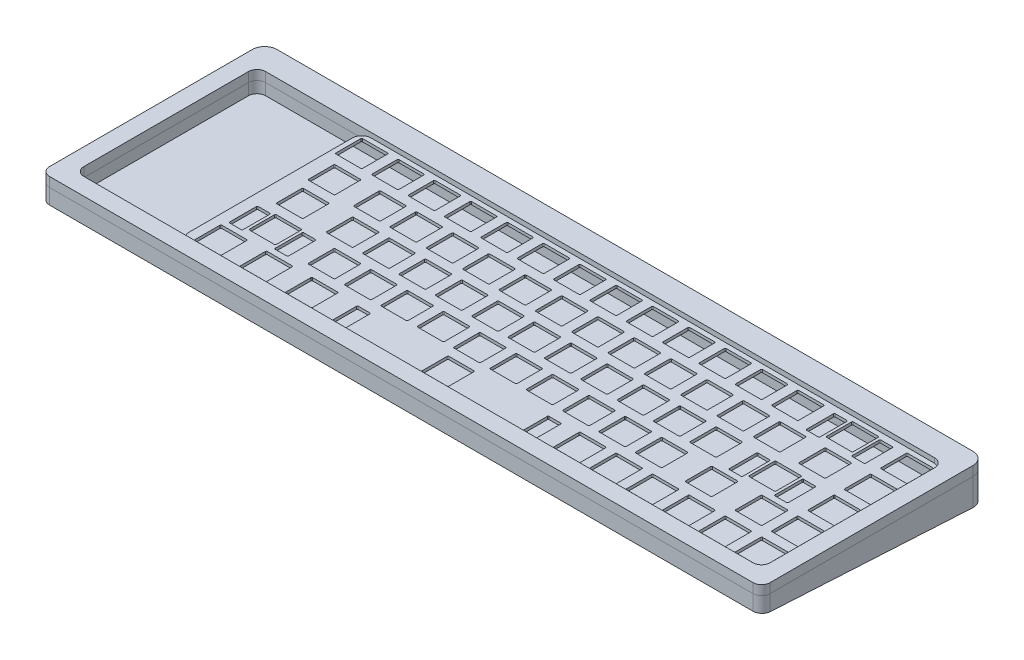
from build123d import *

# Parameters (mm, degrees)
BOSS_EXTRUDE1_DEPTH = 13
SKETCH4_W           = 377.65
SKETCH4_H           = 117.25
BOSS_EXTRUDE3_DEPTH = 10.5
CUT_EXTRUDE3_DEPTH  = 400
FILLET1_R           = 6.5
FILLET4_R           = 4.5
FILLET2_R           = 4.5
SKETCH10_W          = 25
SKETCH10_H          = 7
SKETCH10_H_2        = 7.5
CUT_EXTRUDE2_DEPTH  = 2.5
FILLET3_R           = 4.5
SKETCH9_R           = 1
BOSS_EXTRUDE4_DEPTH = 1.5
SKETCH13_W          = 359.65
SKETCH13_H          = 95.25
BOSS_EXTRUDE5_DEPTH = 1.6


with BuildPart() as part:
    # Sketch2 → Boss-Extrude1 (new body)
    with BuildSketch(Plane(origin=(0, 0, 0), x_dir=(1, 0, 0), z_dir=(0, 1, 0))):
        Polygon((-188.825, 60.625), (-188.825, 54.625), (-188.825, -56.625), (188.825, -56.625), (188.825, 60.625), (-182.825, 60.625), align=None)
        Polygon((-179.825, -46.625), (-179.825, 46.625), (-179.825, 47.625), (-178.825, 47.625), (178.825, 47.625), (179.825, 47.625), (179.825, 46.625), (179.825, -46.625), (179.825, -47.625), (178.825, -47.625), (-178.825, -47.625), (-179.825, -47.625), align=None, mode=Mode.SUBTRACT)
    extrude(amount=BOSS_EXTRUDE1_DEPTH)

    # Sketch4 → Boss-Extrude3 (add)
    with BuildSketch(Plane.XZ):
        with Locations((0, -2)):
            Rectangle(SKETCH4_W, SKETCH4_H)
    extrude(amount=BOSS_EXTRUDE3_DEPTH)

    # Sketch12 → Cut-Extrude3 (cut)
    with BuildSketch(Plane.ZY.offset(188.825)):
        Polygon((-60.625, -10.5), (-60.625, -6.5), (56.625, 0), (56.625, -10.5), align=None)
    extrude(amount=-CUT_EXTRUDE3_DEPTH, mode=Mode.SUBTRACT)

    # Fillet1
    fillet1_edges = [part.edges().sort_by_distance(p)[0] for p in [
        (188.825, 3.25, -60.625),
        (-188.825, 3.25, -60.625),
    ]]
    fillet(fillet1_edges, radius=FILLET1_R)

    # Fillet4
    fillet4_edges = [part.edges().sort_by_distance(p)[0] for p in [
        (188.825, 6.5, 56.625),
        (-188.825, 6.5, 56.625),
    ]]
    fillet(fillet4_edges, radius=FILLET4_R)

    # Fillet2
    fillet2_edges = [part.edges().sort_by_distance(p)[0] for p in [
        (179.825, 6.5, 47.625),
        (-179.825, 6.5, 47.625),
        (179.825, 6.5, -47.625),
        (-179.825, 6.5, -47.625),
    ]]
    fillet(fillet2_edges, radius=FILLET2_R)


with BuildPart() as body_2:
    # Split1: the piece on the far side of the plane
    add(part.part)
    split(bisect_by=Plane.ZX.offset(8), keep=Keep.BOTTOM)


with BuildPart() as part_1:
    add(part.part)

    # Split1
    split(bisect_by=Plane.ZX.offset(8), keep=Keep.TOP)

    # Sketch10 → Cut-Extrude2 (cut)
    with BuildSketch(Plane(origin=(0, 8, 0), x_dir=(1, 0, 0), z_dir=(0, 1, 0))):
        Polygon((-108.245613046, 55.125), (-108.245613046, 47.625), (-83.245613046, 47.625), (-83.245613046, 55.125), (-90.245613046, 55.125), align=None)
        with Locations((-93.199035781, -51.125)):
            Rectangle(SKETCH10_W, SKETCH10_H)
        with Locations((-15.745613046, 51.375)):
            Rectangle(SKETCH10_W, SKETCH10_H_2)
        with Locations((-13.199035781, -51.125)):
            Rectangle(SKETCH10_W, SKETCH10_H)
        with Locations((64.254386954, 51.375)):
            Rectangle(SKETCH10_W, SKETCH10_H_2)
        with Locations((66.800964219, -51.125)):
            Rectangle(SKETCH10_W, SKETCH10_H)
        with Locations((144.254386954, 51.375)):
            Rectangle(SKETCH10_W, SKETCH10_H_2)
        with Locations((146.800964219, -51.125)):
            Rectangle(SKETCH10_W, SKETCH10_H)
    extrude(amount=CUT_EXTRUDE2_DEPTH, mode=Mode.SUBTRACT)

    # Fillet3
    fillet3_edges = [part_1.edges().sort_by_distance(p)[0] for p in [
        (-108.245613046, 9.25, -55.125),
        (-28.245613046, 9.25, -55.125),
        (-3.245613046, 9.25, -55.125),
        (-83.245613046, 9.25, -55.125),
        (76.754386954, 9.25, -55.125),
        (51.754386954, 9.25, -55.125),
        (131.754386954, 9.25, -55.125),
        (156.754386954, 9.25, -55.125),
        (134.300964219, 9.25, 54.625),
        (159.300964219, 9.25, 54.625),
        (79.300964219, 9.25, 54.625),
        (54.300964219, 9.25, 54.625),
        (-25.699035781, 9.25, 54.625),
        (-0.699035781, 9.25, 54.625),
        (-80.699035781, 9.25, 54.625),
        (-105.699035781, 9.25, 54.625),
    ]]
    fillet(fillet3_edges, radius=FILLET3_R)


with BuildPart() as body_3:
    # Sketch9 → Boss-Extrude4 (new body)
    with BuildSketch(Plane(origin=(0, 0, 0), x_dir=(1, 0, 0), z_dir=(0, 1, 0))):
        with BuildLine():
            Line((-103.245613046, 47.625), (-119.970321887, 47.625))
            ThreePointArc((-119.970321887, 47.625), (-123.505855793, 46.160533906), (-124.970321887, 42.625))
            Line((-124.970321887, 42.625), (-124.970321887, -42.625))
            ThreePointArc((-124.970321887, -42.625), (-123.505855793, -46.160533906), (-119.970321887, -47.625))
            Line((-119.970321887, -47.625), (-100.699035781, -47.625))
            Line((-100.699035781, -47.625), (-100.699035781, -52.625))
            ThreePointArc((-100.699035781, -52.625), (-100.113249344, -54.039213562), (-98.699035781, -54.625))
            Line((-98.699035781, -54.625), (-87.699035781, -54.625))
            ThreePointArc((-87.699035781, -54.625), (-86.284822219, -54.039213562), (-85.699035781, -52.625))
            Line((-85.699035781, -52.625), (-85.699035781, -47.625))
            Line((-85.699035781, -47.625), (-20.699035781, -47.625))
            Line((-20.699035781, -47.625), (-20.699035781, -52.625))
            ThreePointArc((-20.699035781, -52.625), (-20.113249344, -54.039213562), (-18.699035781, -54.625))
            Line((-18.699035781, -54.625), (-7.699035781, -54.625))
            ThreePointArc((-7.699035781, -54.625), (-6.284822219, -54.039213562), (-5.699035781, -52.625))
            Line((-5.699035781, -52.625), (-5.699035781, -47.625))
            Line((-5.699035781, -47.625), (59.300964219, -47.625))
            Line((59.300964219, -47.625), (59.300964219, -52.625))
            ThreePointArc((59.300964219, -52.625), (59.886750656, -54.039213562), (61.300964219, -54.625))
            Line((61.300964219, -54.625), (72.300964219, -54.625))
            ThreePointArc((72.300964219, -54.625), (73.715177781, -54.039213562), (74.300964219, -52.625))
            Line((74.300964219, -52.625), (74.300964219, -47.625))
            Line((74.300964219, -47.625), (139.300964219, -47.625))
            Line((139.300964219, -47.625), (139.300964219, -52.625))
            ThreePointArc((139.300964219, -52.625), (139.886750656, -54.039213562), (141.300964219, -54.625))
            Line((141.300964219, -54.625), (152.300964219, -54.625))
            ThreePointArc((152.300964219, -54.625), (153.715177781, -54.039213562), (154.300964219, -52.625))
            Line((154.300964219, -52.625), (154.300964219, -47.625))
            Line((154.300964219, -47.625), (174.829678113, -47.625))
            ThreePointArc((174.829678113, -47.625), (178.287915068, -46.2361767), (179.825, -42.841238864))
            Line((179.825, -42.841238864), (179.825, 42.841238864))
            ThreePointArc((179.825, 42.841238864), (178.287915068, 46.2361767), (174.829678113, 47.625))
            Line((174.829678113, 47.625), (151.754386954, 47.625))
            Line((151.754386954, 47.625), (151.754386954, 53.125))
            ThreePointArc((151.754386954, 53.125), (151.168600516, 54.539213562), (149.754386954, 55.125))
            Line((149.754386954, 55.125), (138.754386954, 55.125))
            ThreePointArc((138.754386954, 55.125), (137.340173391, 54.539213562), (136.754386954, 53.125))
            Line((136.754386954, 53.125), (136.754386954, 47.625))
            Line((136.754386954, 47.625), (71.754386954, 47.625))
            Line((71.754386954, 47.625), (71.754386954, 53.125))
            ThreePointArc((71.754386954, 53.125), (71.168600516, 54.539213562), (69.754386954, 55.125))
            Line((69.754386954, 55.125), (58.754386954, 55.125))
            ThreePointArc((58.754386954, 55.125), (57.340173391, 54.539213562), (56.754386954, 53.125))
            Line((56.754386954, 53.125), (56.754386954, 47.625))
            Line((56.754386954, 47.625), (-8.245613046, 47.625))
            Line((-8.245613046, 47.625), (-8.245613046, 53.125))
            ThreePointArc((-8.245613046, 53.125), (-8.831399484, 54.539213562), (-10.245613046, 55.125))
            Line((-10.245613046, 55.125), (-21.245613046, 55.125))
            ThreePointArc((-21.245613046, 55.125), (-22.659826609, 54.539213562), (-23.245613046, 53.125))
            Line((-23.245613046, 53.125), (-23.245613046, 47.625))
            Line((-23.245613046, 47.625), (-88.245613046, 47.625))
            Line((-88.245613046, 47.625), (-88.245613046, 53.125))
            ThreePointArc((-88.245613046, 53.125), (-88.831399484, 54.539213562), (-90.245613046, 55.125))
            Line((-90.245613046, 55.125), (-101.245613046, 55.125))
            ThreePointArc((-101.245613046, 55.125), (-102.659826609, 54.539213562), (-103.245613046, 53.125))
            Line((-103.245613046, 53.125), (-103.245613046, 47.625))
        make_face()
        with BuildLine():
            ThreePointArc((-120.064071887, -31.6), (-119.917625277, -31.246446609), (-119.564071887, -31.1))
            Line((-119.564071887, -31.1), (-106.564071887, -31.1))
            ThreePointArc((-106.564071887, -31.1), (-106.210518496, -31.246446609), (-106.064071887, -31.6))
            Line((-106.064071887, -31.6), (-106.064071887, -44.6))
            ThreePointArc((-106.064071887, -44.6), (-106.210518496, -44.953553391), (-106.564071887, -45.1))
            Line((-106.564071887, -45.1), (-119.564071887, -45.1))
            ThreePointArc((-119.564071887, -45.1), (-119.917625277, -44.953553391), (-120.064071887, -44.6))
            Line((-120.064071887, -44.6), (-120.064071887, -31.6))
        make_face(mode=Mode.SUBTRACT)
        with BuildLine():
            ThreePointArc((-96.251571887, -31.6), (-96.105125277, -31.246446609), (-95.751571887, -31.1))
            Line((-95.751571887, -31.1), (-82.751571887, -31.1))
            ThreePointArc((-82.751571887, -31.1), (-82.398018496, -31.246446609), (-82.251571887, -31.6))
            Line((-82.251571887, -31.6), (-82.251571887, -44.6))
            ThreePointArc((-82.251571887, -44.6), (-82.398018496, -44.953553391), (-82.751571887, -45.1))
            Line((-82.751571887, -45.1), (-95.751571887, -45.1))
            ThreePointArc((-95.751571887, -45.1), (-96.105125277, -44.953553391), (-96.251571887, -44.6))
            Line((-96.251571887, -44.6), (-96.251571887, -31.6))
        make_face(mode=Mode.SUBTRACT)
        with BuildLine():
            ThreePointArc((-72.439071887, -31.6), (-72.292625277, -31.246446609), (-71.939071887, -31.1))
            Line((-71.939071887, -31.1), (-58.939071887, -31.1))
            ThreePointArc((-58.939071887, -31.1), (-58.585518496, -31.246446609), (-58.439071887, -31.6))
            Line((-58.439071887, -31.6), (-58.439071887, -44.6))
            ThreePointArc((-58.439071887, -44.6), (-58.585518496, -44.953553391), (-58.939071887, -45.1))
            Line((-58.939071887, -45.1), (-71.939071887, -45.1))
            ThreePointArc((-71.939071887, -45.1), (-72.292625277, -44.953553391), (-72.439071887, -44.6))
            Line((-72.439071887, -44.6), (-72.439071887, -31.6))
        make_face(mode=Mode.SUBTRACT)
        with BuildLine():
            ThreePointArc((-47.501571887, -32.6), (-47.355125277, -32.246446609), (-47.001571887, -32.1))
            Line((-47.001571887, -32.1), (-41.001571887, -32.1))
            ThreePointArc((-41.001571887, -32.1), (-40.648018496, -32.246446609), (-40.501571887, -32.6))
            Line((-40.501571887, -32.6), (-40.501571887, -46.6))
            ThreePointArc((-40.501571887, -46.6), (-40.648018496, -46.953553391), (-41.001571887, -47.1))
            Line((-41.001571887, -47.1), (-47.001571887, -47.1))
            ThreePointArc((-47.001571887, -47.1), (-47.355125277, -46.953553391), (-47.501571887, -46.6))
            Line((-47.501571887, -46.6), (-47.501571887, -32.6))
        make_face(mode=Mode.SUBTRACT)
        with BuildLine():
            ThreePointArc((-1.001571887, -31.6), (-0.855125277, -31.246446609), (-0.501571887, -31.1))
            Line((-0.501571887, -31.1), (12.498428113, -31.1))
            ThreePointArc((12.498428113, -31.1), (12.851981504, -31.246446609), (12.998428113, -31.6))
            Line((12.998428113, -31.6), (12.998428113, -44.6))
            ThreePointArc((12.998428113, -44.6), (12.851981504, -44.953553391), (12.498428113, -45.1))
            Line((12.498428113, -45.1), (-0.501571887, -45.1))
            ThreePointArc((-0.501571887, -45.1), (-0.855125277, -44.953553391), (-1.001571887, -44.6))
            Line((-1.001571887, -44.6), (-1.001571887, -31.6))
        make_face(mode=Mode.SUBTRACT)
        with BuildLine():
            ThreePointArc((-118.977071887, -13.55), (-118.830625277, -13.196446609), (-118.477071887, -13.05))
            Line((-118.477071887, -13.05), (-112.477071887, -13.05))
            ThreePointArc((-112.477071887, -13.05), (-112.123518496, -13.196446609), (-111.977071887, -13.55))
            Line((-111.977071887, -13.55), (-111.977071887, -27.55))
            ThreePointArc((-111.977071887, -27.55), (-112.123518496, -27.903553391), (-112.477071887, -28.05))
            Line((-112.477071887, -28.05), (-118.477071887, -28.05))
            ThreePointArc((-118.477071887, -28.05), (-118.830625277, -27.903553391), (-118.977071887, -27.55))
            Line((-118.977071887, -27.55), (-118.977071887, -13.55))
        make_face(mode=Mode.SUBTRACT)
        with BuildLine():
            ThreePointArc((-95.101071887, -13.55), (-94.954625277, -13.196446609), (-94.601071887, -13.05))
            Line((-94.601071887, -13.05), (-88.601071887, -13.05))
            ThreePointArc((-88.601071887, -13.05), (-88.247518496, -13.196446609), (-88.101071887, -13.55))
            Line((-88.101071887, -13.55), (-88.101071887, -27.55))
            ThreePointArc((-88.101071887, -27.55), (-88.247518496, -27.903553391), (-88.601071887, -28.05))
            Line((-88.601071887, -28.05), (-94.601071887, -28.05))
            ThreePointArc((-94.601071887, -28.05), (-94.954625277, -27.903553391), (-95.101071887, -27.55))
            Line((-95.101071887, -27.55), (-95.101071887, -13.55))
        make_face(mode=Mode.SUBTRACT)
        with BuildLine():
            ThreePointArc((-110.539071887, -12.55), (-110.392625277, -12.196446609), (-110.039071887, -12.05))
            Line((-110.039071887, -12.05), (-97.039071887, -12.05))
            ThreePointArc((-97.039071887, -12.05), (-96.685518496, -12.196446609), (-96.539071887, -12.55))
            Line((-96.539071887, -12.55), (-96.539071887, -25.55))
            ThreePointArc((-96.539071887, -25.55), (-96.685518496, -25.903553391), (-97.039071887, -26.05))
            Line((-97.039071887, -26.05), (-110.039071887, -26.05))
            ThreePointArc((-110.039071887, -26.05), (-110.392625277, -25.903553391), (-110.539071887, -25.55))
            Line((-110.539071887, -25.55), (-110.539071887, -12.55))
        make_face(mode=Mode.SUBTRACT)
        with BuildLine():
            ThreePointArc((-79.582821887, -12.55), (-79.436375277, -12.196446609), (-79.082821887, -12.05))
            Line((-79.082821887, -12.05), (-66.082821887, -12.05))
            ThreePointArc((-66.082821887, -12.05), (-65.729268496, -12.196446609), (-65.582821887, -12.55))
            Line((-65.582821887, -12.55), (-65.582821887, -25.55))
            ThreePointArc((-65.582821887, -25.55), (-65.729268496, -25.903553391), (-66.082821887, -26.05))
            Line((-66.082821887, -26.05), (-79.082821887, -26.05))
            ThreePointArc((-79.082821887, -26.05), (-79.436375277, -25.903553391), (-79.582821887, -25.55))
            Line((-79.582821887, -25.55), (-79.582821887, -12.55))
        make_face(mode=Mode.SUBTRACT)
        with BuildLine():
            ThreePointArc((-60.532821887, -12.55), (-60.386375277, -12.196446609), (-60.032821887, -12.05))
            Line((-60.032821887, -12.05), (-47.032821887, -12.05))
            ThreePointArc((-47.032821887, -12.05), (-46.679268496, -12.196446609), (-46.532821887, -12.55))
            Line((-46.532821887, -12.55), (-46.532821887, -25.55))
            ThreePointArc((-46.532821887, -25.55), (-46.679268496, -25.903553391), (-47.032821887, -26.05))
            Line((-47.032821887, -26.05), (-60.032821887, -26.05))
            ThreePointArc((-60.032821887, -26.05), (-60.386375277, -25.903553391), (-60.532821887, -25.55))
            Line((-60.532821887, -25.55), (-60.532821887, -12.55))
        make_face(mode=Mode.SUBTRACT)
        with BuildLine():
            ThreePointArc((-115.301571887, 6.5), (-115.155125277, 6.853553391), (-114.801571887, 7))
            Line((-114.801571887, 7), (-101.801571887, 7))
            ThreePointArc((-101.801571887, 7), (-101.448018496, 6.853553391), (-101.301571887, 6.5))
            Line((-101.301571887, 6.5), (-101.301571887, -6.5))
            ThreePointArc((-101.301571887, -6.5), (-101.448018496, -6.853553391), (-101.801571887, -7))
            Line((-101.801571887, -7), (-114.801571887, -7))
            ThreePointArc((-114.801571887, -7), (-115.155125277, -6.853553391), (-115.301571887, -6.5))
            Line((-115.301571887, -6.5), (-115.301571887, 6.5))
        make_face(mode=Mode.SUBTRACT)
        with BuildLine():
            ThreePointArc((-89.107821887, 6.5), (-88.961375277, 6.853553391), (-88.607821887, 7))
            Line((-88.607821887, 7), (-75.607821887, 7))
            ThreePointArc((-75.607821887, 7), (-75.254268496, 6.853553391), (-75.107821887, 6.5))
            Line((-75.107821887, 6.5), (-75.107821887, -6.5))
            ThreePointArc((-75.107821887, -6.5), (-75.254268496, -6.853553391), (-75.607821887, -7))
            Line((-75.607821887, -7), (-88.607821887, -7))
            ThreePointArc((-88.607821887, -7), (-88.961375277, -6.853553391), (-89.107821887, -6.5))
            Line((-89.107821887, -6.5), (-89.107821887, 6.5))
        make_face(mode=Mode.SUBTRACT)
        with BuildLine():
            ThreePointArc((-70.057821887, 6.5), (-69.911375277, 6.853553391), (-69.557821887, 7))
            Line((-69.557821887, 7), (-56.557821887, 7))
            ThreePointArc((-56.557821887, 7), (-56.204268496, 6.853553391), (-56.057821887, 6.5))
            Line((-56.057821887, 6.5), (-56.057821887, -6.5))
            ThreePointArc((-56.057821887, -6.5), (-56.204268496, -6.853553391), (-56.557821887, -7))
            Line((-56.557821887, -7), (-69.557821887, -7))
            ThreePointArc((-69.557821887, -7), (-69.911375277, -6.853553391), (-70.057821887, -6.5))
            Line((-70.057821887, -6.5), (-70.057821887, 6.5))
        make_face(mode=Mode.SUBTRACT)
        with BuildLine():
            ThreePointArc((-41.482821887, -12.55), (-41.336375277, -12.196446609), (-40.982821887, -12.05))
            Line((-40.982821887, -12.05), (-27.982821887, -12.05))
            ThreePointArc((-27.982821887, -12.05), (-27.629268496, -12.196446609), (-27.482821887, -12.55))
            Line((-27.482821887, -12.55), (-27.482821887, -25.55))
            ThreePointArc((-27.482821887, -25.55), (-27.629268496, -25.903553391), (-27.982821887, -26.05))
            Line((-27.982821887, -26.05), (-40.982821887, -26.05))
            ThreePointArc((-40.982821887, -26.05), (-41.336375277, -25.903553391), (-41.482821887, -25.55))
            Line((-41.482821887, -25.55), (-41.482821887, -12.55))
        make_face(mode=Mode.SUBTRACT)
        with BuildLine():
            ThreePointArc((-22.432821887, -12.55), (-22.286375277, -12.196446609), (-21.932821887, -12.05))
            Line((-21.932821887, -12.05), (-8.932821887, -12.05))
            ThreePointArc((-8.932821887, -12.05), (-8.579268496, -12.196446609), (-8.432821887, -12.55))
            Line((-8.432821887, -12.55), (-8.432821887, -25.55))
            ThreePointArc((-8.432821887, -25.55), (-8.579268496, -25.903553391), (-8.932821887, -26.05))
            Line((-8.932821887, -26.05), (-21.932821887, -26.05))
            ThreePointArc((-21.932821887, -26.05), (-22.286375277, -25.903553391), (-22.432821887, -25.55))
            Line((-22.432821887, -25.55), (-22.432821887, -12.55))
        make_face(mode=Mode.SUBTRACT)
        with BuildLine():
            ThreePointArc((-3.382821887, -12.55), (-3.236375277, -12.196446609), (-2.882821887, -12.05))
            Line((-2.882821887, -12.05), (10.117178113, -12.05))
            ThreePointArc((10.117178113, -12.05), (10.470731504, -12.196446609), (10.617178113, -12.55))
            Line((10.617178113, -12.55), (10.617178113, -25.55))
            ThreePointArc((10.617178113, -25.55), (10.470731504, -25.903553391), (10.117178113, -26.05))
            Line((10.117178113, -26.05), (-2.882821887, -26.05))
            ThreePointArc((-2.882821887, -26.05), (-3.236375277, -25.903553391), (-3.382821887, -25.55))
            Line((-3.382821887, -25.55), (-3.382821887, -12.55))
        make_face(mode=Mode.SUBTRACT)
        with BuildLine():
            ThreePointArc((15.667178113, -12.55), (15.813624723, -12.196446609), (16.167178113, -12.05))
            Line((16.167178113, -12.05), (29.167178113, -12.05))
            ThreePointArc((29.167178113, -12.05), (29.520731504, -12.196446609), (29.667178113, -12.55))
            Line((29.667178113, -12.55), (29.667178113, -25.55))
            ThreePointArc((29.667178113, -25.55), (29.520731504, -25.903553391), (29.167178113, -26.05))
            Line((29.167178113, -26.05), (16.167178113, -26.05))
            ThreePointArc((16.167178113, -26.05), (15.813624723, -25.903553391), (15.667178113, -25.55))
            Line((15.667178113, -25.55), (15.667178113, -12.55))
        make_face(mode=Mode.SUBTRACT)
        with BuildLine():
            ThreePointArc((-51.007821887, 6.5), (-50.861375277, 6.853553391), (-50.507821887, 7))
            Line((-50.507821887, 7), (-37.507821887, 7))
            ThreePointArc((-37.507821887, 7), (-37.154268496, 6.853553391), (-37.007821887, 6.5))
            Line((-37.007821887, 6.5), (-37.007821887, -6.5))
            ThreePointArc((-37.007821887, -6.5), (-37.154268496, -6.853553391), (-37.507821887, -7))
            Line((-37.507821887, -7), (-50.507821887, -7))
            ThreePointArc((-50.507821887, -7), (-50.861375277, -6.853553391), (-51.007821887, -6.5))
            Line((-51.007821887, -6.5), (-51.007821887, 6.5))
        make_face(mode=Mode.SUBTRACT)
        with BuildLine():
            ThreePointArc((-31.957821887, 6.5), (-31.811375277, 6.853553391), (-31.457821887, 7))
            Line((-31.457821887, 7), (-18.457821887, 7))
            ThreePointArc((-18.457821887, 7), (-18.104268496, 6.853553391), (-17.957821887, 6.5))
            Line((-17.957821887, 6.5), (-17.957821887, -6.5))
            ThreePointArc((-17.957821887, -6.5), (-18.104268496, -6.853553391), (-18.457821887, -7))
            Line((-18.457821887, -7), (-31.457821887, -7))
            ThreePointArc((-31.457821887, -7), (-31.811375277, -6.853553391), (-31.957821887, -6.5))
            Line((-31.957821887, -6.5), (-31.957821887, 6.5))
        make_face(mode=Mode.SUBTRACT)
        with BuildLine():
            ThreePointArc((-12.907821887, 6.5), (-12.761375277, 6.853553391), (-12.407821887, 7))
            Line((-12.407821887, 7), (0.592178113, 7))
            ThreePointArc((0.592178113, 7), (0.945731504, 6.853553391), (1.092178113, 6.5))
            Line((1.092178113, 6.5), (1.092178113, -6.5))
            ThreePointArc((1.092178113, -6.5), (0.945731504, -6.853553391), (0.592178113, -7))
            Line((0.592178113, -7), (-12.407821887, -7))
            ThreePointArc((-12.407821887, -7), (-12.761375277, -6.853553391), (-12.907821887, -6.5))
            Line((-12.907821887, -6.5), (-12.907821887, 6.5))
        make_face(mode=Mode.SUBTRACT)
        with BuildLine():
            ThreePointArc((6.142178113, 6.5), (6.288624723, 6.853553391), (6.642178113, 7))
            Line((6.642178113, 7), (19.642178113, 7))
            ThreePointArc((19.642178113, 7), (19.995731504, 6.853553391), (20.142178113, 6.5))
            Line((20.142178113, 6.5), (20.142178113, -6.5))
            ThreePointArc((20.142178113, -6.5), (19.995731504, -6.853553391), (19.642178113, -7))
            Line((19.642178113, -7), (6.642178113, -7))
            ThreePointArc((6.642178113, -7), (6.288624723, -6.853553391), (6.142178113, -6.5))
            Line((6.142178113, -6.5), (6.142178113, 6.5))
        make_face(mode=Mode.SUBTRACT)
        with BuildLine():
            ThreePointArc((52.498428113, -32.6), (52.644874723, -32.246446609), (52.998428113, -32.1))
            Line((52.998428113, -32.1), (58.998428113, -32.1))
            ThreePointArc((58.998428113, -32.1), (59.351981504, -32.246446609), (59.498428113, -32.6))
            Line((59.498428113, -32.6), (59.498428113, -46.6))
            ThreePointArc((59.498428113, -46.6), (59.351981504, -46.953553391), (58.998428113, -47.1))
            Line((58.998428113, -47.1), (52.998428113, -47.1))
            ThreePointArc((52.998428113, -47.1), (52.644874723, -46.953553391), (52.498428113, -46.6))
            Line((52.498428113, -46.6), (52.498428113, -32.6))
        make_face(mode=Mode.SUBTRACT)
        with BuildLine():
            ThreePointArc((68.054678113, -31.6), (68.201124723, -31.246446609), (68.554678113, -31.1))
            Line((68.554678113, -31.1), (81.554678113, -31.1))
            ThreePointArc((81.554678113, -31.1), (81.908231504, -31.246446609), (82.054678113, -31.6))
            Line((82.054678113, -31.6), (82.054678113, -44.6))
            ThreePointArc((82.054678113, -44.6), (81.908231504, -44.953553391), (81.554678113, -45.1))
            Line((81.554678113, -45.1), (68.554678113, -45.1))
            ThreePointArc((68.554678113, -45.1), (68.201124723, -44.953553391), (68.054678113, -44.6))
            Line((68.054678113, -44.6), (68.054678113, -31.6))
        make_face(mode=Mode.SUBTRACT)
        with BuildLine():
            ThreePointArc((87.104678113, -31.6), (87.251124723, -31.246446609), (87.604678113, -31.1))
            Line((87.604678113, -31.1), (100.604678113, -31.1))
            ThreePointArc((100.604678113, -31.1), (100.958231504, -31.246446609), (101.104678113, -31.6))
            Line((101.104678113, -31.6), (101.104678113, -44.6))
            ThreePointArc((101.104678113, -44.6), (100.958231504, -44.953553391), (100.604678113, -45.1))
            Line((100.604678113, -45.1), (87.604678113, -45.1))
            ThreePointArc((87.604678113, -45.1), (87.251124723, -44.953553391), (87.104678113, -44.6))
            Line((87.104678113, -44.6), (87.104678113, -31.6))
        make_face(mode=Mode.SUBTRACT)
        with BuildLine():
            ThreePointArc((106.154678113, -31.6), (106.301124723, -31.246446609), (106.654678113, -31.1))
            Line((106.654678113, -31.1), (119.654678113, -31.1))
            ThreePointArc((119.654678113, -31.1), (120.008231504, -31.246446609), (120.154678113, -31.6))
            Line((120.154678113, -31.6), (120.154678113, -44.6))
            ThreePointArc((120.154678113, -44.6), (120.008231504, -44.953553391), (119.654678113, -45.1))
            Line((119.654678113, -45.1), (106.654678113, -45.1))
            ThreePointArc((106.654678113, -45.1), (106.301124723, -44.953553391), (106.154678113, -44.6))
            Line((106.154678113, -44.6), (106.154678113, -31.6))
        make_face(mode=Mode.SUBTRACT)
        with BuildLine():
            ThreePointArc((125.204678113, -31.6), (125.351124723, -31.246446609), (125.704678113, -31.1))
            Line((125.704678113, -31.1), (138.704678113, -31.1))
            ThreePointArc((138.704678113, -31.1), (139.058231504, -31.246446609), (139.204678113, -31.6))
            Line((139.204678113, -31.6), (139.204678113, -44.6))
            ThreePointArc((139.204678113, -44.6), (139.058231504, -44.953553391), (138.704678113, -45.1))
            Line((138.704678113, -45.1), (125.704678113, -45.1))
            ThreePointArc((125.704678113, -45.1), (125.351124723, -44.953553391), (125.204678113, -44.6))
            Line((125.204678113, -44.6), (125.204678113, -31.6))
        make_face(mode=Mode.SUBTRACT)
        with BuildLine():
            ThreePointArc((144.254678113, -31.6), (144.401124723, -31.246446609), (144.754678113, -31.1))
            Line((144.754678113, -31.1), (157.754678113, -31.1))
            ThreePointArc((157.754678113, -31.1), (158.108231504, -31.246446609), (158.254678113, -31.6))
            Line((158.254678113, -31.6), (158.254678113, -44.6))
            ThreePointArc((158.254678113, -44.6), (158.108231504, -44.953553391), (157.754678113, -45.1))
            Line((157.754678113, -45.1), (144.754678113, -45.1))
            ThreePointArc((144.754678113, -45.1), (144.401124723, -44.953553391), (144.254678113, -44.6))
            Line((144.254678113, -44.6), (144.254678113, -31.6))
        make_face(mode=Mode.SUBTRACT)
        with BuildLine():
            ThreePointArc((163.304678113, -31.6), (163.451124723, -31.246446609), (163.804678113, -31.1))
            Line((163.804678113, -31.1), (176.804678113, -31.1))
            ThreePointArc((176.804678113, -31.1), (177.158231504, -31.246446609), (177.304678113, -31.6))
            Line((177.304678113, -31.6), (177.304678113, -44.6))
            ThreePointArc((177.304678113, -44.6), (177.158231504, -44.953553391), (176.804678113, -45.1))
            Line((176.804678113, -45.1), (163.804678113, -45.1))
            ThreePointArc((163.804678113, -45.1), (163.451124723, -44.953553391), (163.304678113, -44.6))
            Line((163.304678113, -44.6), (163.304678113, -31.6))
        make_face(mode=Mode.SUBTRACT)
        with BuildLine():
            ThreePointArc((34.717178113, -12.55), (34.863624723, -12.196446609), (35.217178113, -12.05))
            Line((35.217178113, -12.05), (48.217178113, -12.05))
            ThreePointArc((48.217178113, -12.05), (48.570731504, -12.196446609), (48.717178113, -12.55))
            Line((48.717178113, -12.55), (48.717178113, -25.55))
            ThreePointArc((48.717178113, -25.55), (48.570731504, -25.903553391), (48.217178113, -26.05))
            Line((48.217178113, -26.05), (35.217178113, -26.05))
            ThreePointArc((35.217178113, -26.05), (34.863624723, -25.903553391), (34.717178113, -25.55))
            Line((34.717178113, -25.55), (34.717178113, -12.55))
        make_face(mode=Mode.SUBTRACT)
        with BuildLine():
            ThreePointArc((53.767178113, -12.55), (53.913624723, -12.196446609), (54.267178113, -12.05))
            Line((54.267178113, -12.05), (67.267178113, -12.05))
            ThreePointArc((67.267178113, -12.05), (67.620731504, -12.196446609), (67.767178113, -12.55))
            Line((67.767178113, -12.55), (67.767178113, -25.55))
            ThreePointArc((67.767178113, -25.55), (67.620731504, -25.903553391), (67.267178113, -26.05))
            Line((67.267178113, -26.05), (54.267178113, -26.05))
            ThreePointArc((54.267178113, -26.05), (53.913624723, -25.903553391), (53.767178113, -25.55))
            Line((53.767178113, -25.55), (53.767178113, -12.55))
        make_face(mode=Mode.SUBTRACT)
        with BuildLine():
            ThreePointArc((72.817178113, -12.55), (72.963624723, -12.196446609), (73.317178113, -12.05))
            Line((73.317178113, -12.05), (86.317178113, -12.05))
            ThreePointArc((86.317178113, -12.05), (86.670731504, -12.196446609), (86.817178113, -12.55))
            Line((86.817178113, -12.55), (86.817178113, -25.55))
            ThreePointArc((86.817178113, -25.55), (86.670731504, -25.903553391), (86.317178113, -26.05))
            Line((86.317178113, -26.05), (73.317178113, -26.05))
            ThreePointArc((73.317178113, -26.05), (72.963624723, -25.903553391), (72.817178113, -25.55))
            Line((72.817178113, -25.55), (72.817178113, -12.55))
        make_face(mode=Mode.SUBTRACT)
        with BuildLine():
            ThreePointArc((91.867178113, -12.55), (92.013624723, -12.196446609), (92.367178113, -12.05))
            Line((92.367178113, -12.05), (105.367178113, -12.05))
            ThreePointArc((105.367178113, -12.05), (105.720731504, -12.196446609), (105.867178113, -12.55))
            Line((105.867178113, -12.55), (105.867178113, -25.55))
            ThreePointArc((105.867178113, -25.55), (105.720731504, -25.903553391), (105.367178113, -26.05))
            Line((105.367178113, -26.05), (92.367178113, -26.05))
            ThreePointArc((92.367178113, -26.05), (92.013624723, -25.903553391), (91.867178113, -25.55))
            Line((91.867178113, -25.55), (91.867178113, -12.55))
        make_face(mode=Mode.SUBTRACT)
        with BuildLine():
            ThreePointArc((25.192178113, 6.5), (25.338624723, 6.853553391), (25.692178113, 7))
            Line((25.692178113, 7), (38.692178113, 7))
            ThreePointArc((38.692178113, 7), (39.045731504, 6.853553391), (39.192178113, 6.5))
            Line((39.192178113, 6.5), (39.192178113, -6.5))
            ThreePointArc((39.192178113, -6.5), (39.045731504, -6.853553391), (38.692178113, -7))
            Line((38.692178113, -7), (25.692178113, -7))
            ThreePointArc((25.692178113, -7), (25.338624723, -6.853553391), (25.192178113, -6.5))
            Line((25.192178113, -6.5), (25.192178113, 6.5))
        make_face(mode=Mode.SUBTRACT)
        with BuildLine():
            ThreePointArc((44.242178113, 6.5), (44.388624723, 6.853553391), (44.742178113, 7))
            Line((44.742178113, 7), (57.742178113, 7))
            ThreePointArc((57.742178113, 7), (58.095731504, 6.853553391), (58.242178113, 6.5))
            Line((58.242178113, 6.5), (58.242178113, -6.5))
            ThreePointArc((58.242178113, -6.5), (58.095731504, -6.853553391), (57.742178113, -7))
            Line((57.742178113, -7), (44.742178113, -7))
            ThreePointArc((44.742178113, -7), (44.388624723, -6.853553391), (44.242178113, -6.5))
            Line((44.242178113, -6.5), (44.242178113, 6.5))
        make_face(mode=Mode.SUBTRACT)
        with BuildLine():
            ThreePointArc((63.292178113, 6.5), (63.438624723, 6.853553391), (63.792178113, 7))
            Line((63.792178113, 7), (76.792178113, 7))
            ThreePointArc((76.792178113, 7), (77.145731504, 6.853553391), (77.292178113, 6.5))
            Line((77.292178113, 6.5), (77.292178113, -6.5))
            ThreePointArc((77.292178113, -6.5), (77.145731504, -6.853553391), (76.792178113, -7))
            Line((76.792178113, -7), (63.792178113, -7))
            ThreePointArc((63.792178113, -7), (63.438624723, -6.853553391), (63.292178113, -6.5))
            Line((63.292178113, -6.5), (63.292178113, 6.5))
        make_face(mode=Mode.SUBTRACT)
        with BuildLine():
            ThreePointArc((82.342178113, 6.5), (82.488624723, 6.853553391), (82.842178113, 7))
            Line((82.842178113, 7), (95.842178113, 7))
            ThreePointArc((95.842178113, 7), (96.195731504, 6.853553391), (96.342178113, 6.5))
            Line((96.342178113, 6.5), (96.342178113, -6.5))
            ThreePointArc((96.342178113, -6.5), (96.195731504, -6.853553391), (95.842178113, -7))
            Line((95.842178113, -7), (82.842178113, -7))
            ThreePointArc((82.842178113, -7), (82.488624723, -6.853553391), (82.342178113, -6.5))
            Line((82.342178113, -6.5), (82.342178113, 6.5))
        make_face(mode=Mode.SUBTRACT)
        with BuildLine():
            ThreePointArc((118.060928113, -12.55), (118.207374723, -12.196446609), (118.560928113, -12.05))
            Line((118.560928113, -12.05), (131.560928113, -12.05))
            ThreePointArc((131.560928113, -12.05), (131.914481504, -12.196446609), (132.060928113, -12.55))
            Line((132.060928113, -12.55), (132.060928113, -25.55))
            ThreePointArc((132.060928113, -25.55), (131.914481504, -25.903553391), (131.560928113, -26.05))
            Line((131.560928113, -26.05), (118.560928113, -26.05))
            ThreePointArc((118.560928113, -26.05), (118.207374723, -25.903553391), (118.060928113, -25.55))
            Line((118.060928113, -25.55), (118.060928113, -12.55))
        make_face(mode=Mode.SUBTRACT)
        with BuildLine():
            ThreePointArc((144.254678113, -12.55), (144.401124723, -12.196446609), (144.754678113, -12.05))
            Line((144.754678113, -12.05), (157.754678113, -12.05))
            ThreePointArc((157.754678113, -12.05), (158.108231504, -12.196446609), (158.254678113, -12.55))
            Line((158.254678113, -12.55), (158.254678113, -25.55))
            ThreePointArc((158.254678113, -25.55), (158.108231504, -25.903553391), (157.754678113, -26.05))
            Line((157.754678113, -26.05), (144.754678113, -26.05))
            ThreePointArc((144.754678113, -26.05), (144.401124723, -25.903553391), (144.254678113, -25.55))
            Line((144.254678113, -25.55), (144.254678113, -12.55))
        make_face(mode=Mode.SUBTRACT)
        with BuildLine():
            ThreePointArc((163.304678113, -12.55), (163.451124723, -12.196446609), (163.804678113, -12.05))
            Line((163.804678113, -12.05), (176.804678113, -12.05))
            ThreePointArc((176.804678113, -12.05), (177.158231504, -12.196446609), (177.304678113, -12.55))
            Line((177.304678113, -12.55), (177.304678113, -25.55))
            ThreePointArc((177.304678113, -25.55), (177.158231504, -25.903553391), (176.804678113, -26.05))
            Line((176.804678113, -26.05), (163.804678113, -26.05))
            ThreePointArc((163.804678113, -26.05), (163.451124723, -25.903553391), (163.304678113, -25.55))
            Line((163.304678113, -25.55), (163.304678113, -12.55))
        make_face(mode=Mode.SUBTRACT)
        with BuildLine():
            ThreePointArc((101.392178113, 6.5), (101.538624723, 6.853553391), (101.892178113, 7))
            Line((101.892178113, 7), (114.892178113, 7))
            ThreePointArc((114.892178113, 7), (115.245731504, 6.853553391), (115.392178113, 6.5))
            Line((115.392178113, 6.5), (115.392178113, -6.5))
            ThreePointArc((115.392178113, -6.5), (115.245731504, -6.853553391), (114.892178113, -7))
            Line((114.892178113, -7), (101.892178113, -7))
            ThreePointArc((101.892178113, -7), (101.538624723, -6.853553391), (101.392178113, -6.5))
            Line((101.392178113, -6.5), (101.392178113, 6.5))
        make_face(mode=Mode.SUBTRACT)
        with BuildLine():
            ThreePointArc((123.910428113, 5.5), (124.056874723, 5.853553391), (124.410428113, 6))
            Line((124.410428113, 6), (130.410428113, 6))
            ThreePointArc((130.410428113, 6), (130.763981504, 5.853553391), (130.910428113, 5.5))
            Line((130.910428113, 5.5), (130.910428113, -8.5))
            ThreePointArc((130.910428113, -8.5), (130.763981504, -8.853553391), (130.410428113, -9))
            Line((130.410428113, -9), (124.410428113, -9))
            ThreePointArc((124.410428113, -9), (124.056874723, -8.853553391), (123.910428113, -8.5))
            Line((123.910428113, -8.5), (123.910428113, 5.5))
        make_face(mode=Mode.SUBTRACT)
        with BuildLine():
            ThreePointArc((132.348428113, 6.5), (132.494874723, 6.853553391), (132.848428113, 7))
            Line((132.848428113, 7), (145.848428113, 7))
            ThreePointArc((145.848428113, 7), (146.201981504, 6.853553391), (146.348428113, 6.5))
            Line((146.348428113, 6.5), (146.348428113, -6.5))
            ThreePointArc((146.348428113, -6.5), (146.201981504, -6.853553391), (145.848428113, -7))
            Line((145.848428113, -7), (132.848428113, -7))
            ThreePointArc((132.848428113, -7), (132.494874723, -6.853553391), (132.348428113, -6.5))
            Line((132.348428113, -6.5), (132.348428113, 6.5))
        make_face(mode=Mode.SUBTRACT)
        with BuildLine():
            ThreePointArc((147.786428113, 5.5), (147.932874723, 5.853553391), (148.286428113, 6))
            Line((148.286428113, 6), (154.286428113, 6))
            ThreePointArc((154.286428113, 6), (154.639981504, 5.853553391), (154.786428113, 5.5))
            Line((154.786428113, 5.5), (154.786428113, -8.5))
            ThreePointArc((154.786428113, -8.5), (154.639981504, -8.853553391), (154.286428113, -9))
            Line((154.286428113, -9), (148.286428113, -9))
            ThreePointArc((148.286428113, -9), (147.932874723, -8.853553391), (147.786428113, -8.5))
            Line((147.786428113, -8.5), (147.786428113, 5.5))
        make_face(mode=Mode.SUBTRACT)
        with BuildLine():
            ThreePointArc((163.304678113, 6.5), (163.451124723, 6.853553391), (163.804678113, 7))
            Line((163.804678113, 7), (176.804678113, 7))
            ThreePointArc((176.804678113, 7), (177.158231504, 6.853553391), (177.304678113, 6.5))
            Line((177.304678113, 6.5), (177.304678113, -6.5))
            ThreePointArc((177.304678113, -6.5), (177.158231504, -6.853553391), (176.804678113, -7))
            Line((176.804678113, -7), (163.804678113, -7))
            ThreePointArc((163.804678113, -7), (163.451124723, -6.853553391), (163.304678113, -6.5))
            Line((163.304678113, -6.5), (163.304678113, 6.5))
        make_face(mode=Mode.SUBTRACT)
        with BuildLine():
            ThreePointArc((-117.682821887, 25.55), (-117.536375277, 25.903553391), (-117.182821887, 26.05))
            Line((-117.182821887, 26.05), (-104.182821887, 26.05))
            ThreePointArc((-104.182821887, 26.05), (-103.829268496, 25.903553391), (-103.682821887, 25.55))
            Line((-103.682821887, 25.55), (-103.682821887, 12.55))
            ThreePointArc((-103.682821887, 12.55), (-103.829268496, 12.196446609), (-104.182821887, 12.05))
            Line((-104.182821887, 12.05), (-117.182821887, 12.05))
            ThreePointArc((-117.182821887, 12.05), (-117.536375277, 12.196446609), (-117.682821887, 12.55))
            Line((-117.682821887, 12.55), (-117.682821887, 25.55))
        make_face(mode=Mode.SUBTRACT)
        with BuildLine():
            ThreePointArc((-93.870321887, 25.55), (-93.723875277, 25.903553391), (-93.370321887, 26.05))
            Line((-93.370321887, 26.05), (-80.370321887, 26.05))
            ThreePointArc((-80.370321887, 26.05), (-80.016768496, 25.903553391), (-79.870321887, 25.55))
            Line((-79.870321887, 25.55), (-79.870321887, 12.55))
            ThreePointArc((-79.870321887, 12.55), (-80.016768496, 12.196446609), (-80.370321887, 12.05))
            Line((-80.370321887, 12.05), (-93.370321887, 12.05))
            ThreePointArc((-93.370321887, 12.05), (-93.723875277, 12.196446609), (-93.870321887, 12.55))
            Line((-93.870321887, 12.55), (-93.870321887, 25.55))
        make_face(mode=Mode.SUBTRACT)
        with BuildLine():
            ThreePointArc((-74.820321887, 25.55), (-74.673875277, 25.903553391), (-74.320321887, 26.05))
            Line((-74.320321887, 26.05), (-61.320321887, 26.05))
            ThreePointArc((-61.320321887, 26.05), (-60.966768496, 25.903553391), (-60.820321887, 25.55))
            Line((-60.820321887, 25.55), (-60.820321887, 12.55))
            ThreePointArc((-60.820321887, 12.55), (-60.966768496, 12.196446609), (-61.320321887, 12.05))
            Line((-61.320321887, 12.05), (-74.320321887, 12.05))
            ThreePointArc((-74.320321887, 12.05), (-74.673875277, 12.196446609), (-74.820321887, 12.55))
            Line((-74.820321887, 12.55), (-74.820321887, 25.55))
        make_face(mode=Mode.SUBTRACT)
        with BuildLine():
            ThreePointArc((-55.770321887, 25.55), (-55.623875277, 25.903553391), (-55.270321887, 26.05))
            Line((-55.270321887, 26.05), (-42.270321887, 26.05))
            ThreePointArc((-42.270321887, 26.05), (-41.916768496, 25.903553391), (-41.770321887, 25.55))
            Line((-41.770321887, 25.55), (-41.770321887, 12.55))
            ThreePointArc((-41.770321887, 12.55), (-41.916768496, 12.196446609), (-42.270321887, 12.05))
            Line((-42.270321887, 12.05), (-55.270321887, 12.05))
            ThreePointArc((-55.270321887, 12.05), (-55.623875277, 12.196446609), (-55.770321887, 12.55))
            Line((-55.770321887, 12.55), (-55.770321887, 25.55))
        make_face(mode=Mode.SUBTRACT)
        with BuildLine():
            ThreePointArc((-36.720321887, 25.55), (-36.573875277, 25.903553391), (-36.220321887, 26.05))
            Line((-36.220321887, 26.05), (-23.220321887, 26.05))
            ThreePointArc((-23.220321887, 26.05), (-22.866768496, 25.903553391), (-22.720321887, 25.55))
            Line((-22.720321887, 25.55), (-22.720321887, 12.55))
            ThreePointArc((-22.720321887, 12.55), (-22.866768496, 12.196446609), (-23.220321887, 12.05))
            Line((-23.220321887, 12.05), (-36.220321887, 12.05))
            ThreePointArc((-36.220321887, 12.05), (-36.573875277, 12.196446609), (-36.720321887, 12.55))
            Line((-36.720321887, 12.55), (-36.720321887, 25.55))
        make_face(mode=Mode.SUBTRACT)
        with BuildLine():
            ThreePointArc((-17.670321887, 25.55), (-17.523875277, 25.903553391), (-17.170321887, 26.05))
            Line((-17.170321887, 26.05), (-4.170321887, 26.05))
            ThreePointArc((-4.170321887, 26.05), (-3.816768496, 25.903553391), (-3.670321887, 25.55))
            Line((-3.670321887, 25.55), (-3.670321887, 12.55))
            ThreePointArc((-3.670321887, 12.55), (-3.816768496, 12.196446609), (-4.170321887, 12.05))
            Line((-4.170321887, 12.05), (-17.170321887, 12.05))
            ThreePointArc((-17.170321887, 12.05), (-17.523875277, 12.196446609), (-17.670321887, 12.55))
            Line((-17.670321887, 12.55), (-17.670321887, 25.55))
        make_face(mode=Mode.SUBTRACT)
        with BuildLine():
            ThreePointArc((1.379678113, 25.55), (1.526124723, 25.903553391), (1.879678113, 26.05))
            Line((1.879678113, 26.05), (14.879678113, 26.05))
            ThreePointArc((14.879678113, 26.05), (15.233231504, 25.903553391), (15.379678113, 25.55))
            Line((15.379678113, 25.55), (15.379678113, 12.55))
            ThreePointArc((15.379678113, 12.55), (15.233231504, 12.196446609), (14.879678113, 12.05))
            Line((14.879678113, 12.05), (1.879678113, 12.05))
            ThreePointArc((1.879678113, 12.05), (1.526124723, 12.196446609), (1.379678113, 12.55))
            Line((1.379678113, 12.55), (1.379678113, 25.55))
        make_face(mode=Mode.SUBTRACT)
        with BuildLine():
            ThreePointArc((-122.445321887, 44.6), (-122.298875277, 44.953553391), (-121.945321887, 45.1))
            Line((-121.945321887, 45.1), (-108.945321887, 45.1))
            ThreePointArc((-108.945321887, 45.1), (-108.591768496, 44.953553391), (-108.445321887, 44.6))
            Line((-108.445321887, 44.6), (-108.445321887, 31.6))
            ThreePointArc((-108.445321887, 31.6), (-108.591768496, 31.246446609), (-108.945321887, 31.1))
            Line((-108.945321887, 31.1), (-121.945321887, 31.1))
            ThreePointArc((-121.945321887, 31.1), (-122.298875277, 31.246446609), (-122.445321887, 31.6))
            Line((-122.445321887, 31.6), (-122.445321887, 44.6))
        make_face(mode=Mode.SUBTRACT)
        with BuildLine():
            ThreePointArc((-103.395321887, 44.6), (-103.248875277, 44.953553391), (-102.895321887, 45.1))
            Line((-102.895321887, 45.1), (-89.895321887, 45.1))
            ThreePointArc((-89.895321887, 45.1), (-89.541768496, 44.953553391), (-89.395321887, 44.6))
            Line((-89.395321887, 44.6), (-89.395321887, 31.6))
            ThreePointArc((-89.395321887, 31.6), (-89.541768496, 31.246446609), (-89.895321887, 31.1))
            Line((-89.895321887, 31.1), (-102.895321887, 31.1))
            ThreePointArc((-102.895321887, 31.1), (-103.248875277, 31.246446609), (-103.395321887, 31.6))
            Line((-103.395321887, 31.6), (-103.395321887, 44.6))
        make_face(mode=Mode.SUBTRACT)
        with BuildLine():
            ThreePointArc((-84.345321887, 44.6), (-84.198875277, 44.953553391), (-83.845321887, 45.1))
            Line((-83.845321887, 45.1), (-70.845321887, 45.1))
            ThreePointArc((-70.845321887, 45.1), (-70.491768496, 44.953553391), (-70.345321887, 44.6))
            Line((-70.345321887, 44.6), (-70.345321887, 31.6))
            ThreePointArc((-70.345321887, 31.6), (-70.491768496, 31.246446609), (-70.845321887, 31.1))
            Line((-70.845321887, 31.1), (-83.845321887, 31.1))
            ThreePointArc((-83.845321887, 31.1), (-84.198875277, 31.246446609), (-84.345321887, 31.6))
            Line((-84.345321887, 31.6), (-84.345321887, 44.6))
        make_face(mode=Mode.SUBTRACT)
        with BuildLine():
            ThreePointArc((-65.295321887, 44.6), (-65.148875277, 44.953553391), (-64.795321887, 45.1))
            Line((-64.795321887, 45.1), (-51.795321887, 45.1))
            ThreePointArc((-51.795321887, 45.1), (-51.441768496, 44.953553391), (-51.295321887, 44.6))
            Line((-51.295321887, 44.6), (-51.295321887, 31.6))
            ThreePointArc((-51.295321887, 31.6), (-51.441768496, 31.246446609), (-51.795321887, 31.1))
            Line((-51.795321887, 31.1), (-64.795321887, 31.1))
            ThreePointArc((-64.795321887, 31.1), (-65.148875277, 31.246446609), (-65.295321887, 31.6))
            Line((-65.295321887, 31.6), (-65.295321887, 44.6))
        make_face(mode=Mode.SUBTRACT)
        with BuildLine():
            ThreePointArc((-46.245321887, 44.6), (-46.098875277, 44.953553391), (-45.745321887, 45.1))
            Line((-45.745321887, 45.1), (-32.745321887, 45.1))
            ThreePointArc((-32.745321887, 45.1), (-32.391768496, 44.953553391), (-32.245321887, 44.6))
            Line((-32.245321887, 44.6), (-32.245321887, 31.6))
            ThreePointArc((-32.245321887, 31.6), (-32.391768496, 31.246446609), (-32.745321887, 31.1))
            Line((-32.745321887, 31.1), (-45.745321887, 31.1))
            ThreePointArc((-45.745321887, 31.1), (-46.098875277, 31.246446609), (-46.245321887, 31.6))
            Line((-46.245321887, 31.6), (-46.245321887, 44.6))
        make_face(mode=Mode.SUBTRACT)
        with BuildLine():
            ThreePointArc((-27.195321887, 44.6), (-27.048875277, 44.953553391), (-26.695321887, 45.1))
            Line((-26.695321887, 45.1), (-13.695321887, 45.1))
            ThreePointArc((-13.695321887, 45.1), (-13.341768496, 44.953553391), (-13.195321887, 44.6))
            Line((-13.195321887, 44.6), (-13.195321887, 31.6))
            ThreePointArc((-13.195321887, 31.6), (-13.341768496, 31.246446609), (-13.695321887, 31.1))
            Line((-13.695321887, 31.1), (-26.695321887, 31.1))
            ThreePointArc((-26.695321887, 31.1), (-27.048875277, 31.246446609), (-27.195321887, 31.6))
            Line((-27.195321887, 31.6), (-27.195321887, 44.6))
        make_face(mode=Mode.SUBTRACT)
        with BuildLine():
            ThreePointArc((-8.145321887, 44.6), (-7.998875277, 44.953553391), (-7.645321887, 45.1))
            Line((-7.645321887, 45.1), (5.354678113, 45.1))
            ThreePointArc((5.354678113, 45.1), (5.708231504, 44.953553391), (5.854678113, 44.6))
            Line((5.854678113, 44.6), (5.854678113, 31.6))
            ThreePointArc((5.854678113, 31.6), (5.708231504, 31.246446609), (5.354678113, 31.1))
            Line((5.354678113, 31.1), (-7.645321887, 31.1))
            ThreePointArc((-7.645321887, 31.1), (-7.998875277, 31.246446609), (-8.145321887, 31.6))
            Line((-8.145321887, 31.6), (-8.145321887, 44.6))
        make_face(mode=Mode.SUBTRACT)
        with BuildLine():
            ThreePointArc((10.904678113, 44.6), (11.051124723, 44.953553391), (11.404678113, 45.1))
            Line((11.404678113, 45.1), (24.404678113, 45.1))
            ThreePointArc((24.404678113, 45.1), (24.758231504, 44.953553391), (24.904678113, 44.6))
            Line((24.904678113, 44.6), (24.904678113, 31.6))
            ThreePointArc((24.904678113, 31.6), (24.758231504, 31.246446609), (24.404678113, 31.1))
            Line((24.404678113, 31.1), (11.404678113, 31.1))
            ThreePointArc((11.404678113, 31.1), (11.051124723, 31.246446609), (10.904678113, 31.6))
            Line((10.904678113, 31.6), (10.904678113, 44.6))
        make_face(mode=Mode.SUBTRACT)
        with BuildLine():
            ThreePointArc((20.429678113, 25.55), (20.576124723, 25.903553391), (20.929678113, 26.05))
            Line((20.929678113, 26.05), (33.929678113, 26.05))
            ThreePointArc((33.929678113, 26.05), (34.283231504, 25.903553391), (34.429678113, 25.55))
            Line((34.429678113, 25.55), (34.429678113, 12.55))
            ThreePointArc((34.429678113, 12.55), (34.283231504, 12.196446609), (33.929678113, 12.05))
            Line((33.929678113, 12.05), (20.929678113, 12.05))
            ThreePointArc((20.929678113, 12.05), (20.576124723, 12.196446609), (20.429678113, 12.55))
            Line((20.429678113, 12.55), (20.429678113, 25.55))
        make_face(mode=Mode.SUBTRACT)
        with BuildLine():
            ThreePointArc((39.479678113, 25.55), (39.626124723, 25.903553391), (39.979678113, 26.05))
            Line((39.979678113, 26.05), (52.979678113, 26.05))
            ThreePointArc((52.979678113, 26.05), (53.333231504, 25.903553391), (53.479678113, 25.55))
            Line((53.479678113, 25.55), (53.479678113, 12.55))
            ThreePointArc((53.479678113, 12.55), (53.333231504, 12.196446609), (52.979678113, 12.05))
            Line((52.979678113, 12.05), (39.979678113, 12.05))
            ThreePointArc((39.979678113, 12.05), (39.626124723, 12.196446609), (39.479678113, 12.55))
            Line((39.479678113, 12.55), (39.479678113, 25.55))
        make_face(mode=Mode.SUBTRACT)
        with BuildLine():
            ThreePointArc((58.529678113, 25.55), (58.676124723, 25.903553391), (59.029678113, 26.05))
            Line((59.029678113, 26.05), (72.029678113, 26.05))
            ThreePointArc((72.029678113, 26.05), (72.383231504, 25.903553391), (72.529678113, 25.55))
            Line((72.529678113, 25.55), (72.529678113, 12.55))
            ThreePointArc((72.529678113, 12.55), (72.383231504, 12.196446609), (72.029678113, 12.05))
            Line((72.029678113, 12.05), (59.029678113, 12.05))
            ThreePointArc((59.029678113, 12.05), (58.676124723, 12.196446609), (58.529678113, 12.55))
            Line((58.529678113, 12.55), (58.529678113, 25.55))
        make_face(mode=Mode.SUBTRACT)
        with BuildLine():
            ThreePointArc((77.579678113, 25.55), (77.726124723, 25.903553391), (78.079678113, 26.05))
            Line((78.079678113, 26.05), (91.079678113, 26.05))
            ThreePointArc((91.079678113, 26.05), (91.433231504, 25.903553391), (91.579678113, 25.55))
            Line((91.579678113, 25.55), (91.579678113, 12.55))
            ThreePointArc((91.579678113, 12.55), (91.433231504, 12.196446609), (91.079678113, 12.05))
            Line((91.079678113, 12.05), (78.079678113, 12.05))
            ThreePointArc((78.079678113, 12.05), (77.726124723, 12.196446609), (77.579678113, 12.55))
            Line((77.579678113, 12.55), (77.579678113, 25.55))
        make_face(mode=Mode.SUBTRACT)
        with BuildLine():
            ThreePointArc((96.629678113, 25.55), (96.776124723, 25.903553391), (97.129678113, 26.05))
            Line((97.129678113, 26.05), (110.129678113, 26.05))
            ThreePointArc((110.129678113, 26.05), (110.483231504, 25.903553391), (110.629678113, 25.55))
            Line((110.629678113, 25.55), (110.629678113, 12.55))
            ThreePointArc((110.629678113, 12.55), (110.483231504, 12.196446609), (110.129678113, 12.05))
            Line((110.129678113, 12.05), (97.129678113, 12.05))
            ThreePointArc((97.129678113, 12.05), (96.776124723, 12.196446609), (96.629678113, 12.55))
            Line((96.629678113, 12.55), (96.629678113, 25.55))
        make_face(mode=Mode.SUBTRACT)
        with BuildLine():
            ThreePointArc((115.679678113, 25.55), (115.826124723, 25.903553391), (116.179678113, 26.05))
            Line((116.179678113, 26.05), (129.179678113, 26.05))
            ThreePointArc((129.179678113, 26.05), (129.533231504, 25.903553391), (129.679678113, 25.55))
            Line((129.679678113, 25.55), (129.679678113, 12.55))
            ThreePointArc((129.679678113, 12.55), (129.533231504, 12.196446609), (129.179678113, 12.05))
            Line((129.179678113, 12.05), (116.179678113, 12.05))
            ThreePointArc((116.179678113, 12.05), (115.826124723, 12.196446609), (115.679678113, 12.55))
            Line((115.679678113, 12.55), (115.679678113, 25.55))
        make_face(mode=Mode.SUBTRACT)
        with BuildLine():
            ThreePointArc((139.492178113, 25.55), (139.638624723, 25.903553391), (139.992178113, 26.05))
            Line((139.992178113, 26.05), (152.992178113, 26.05))
            ThreePointArc((152.992178113, 26.05), (153.345731504, 25.903553391), (153.492178113, 25.55))
            Line((153.492178113, 25.55), (153.492178113, 12.55))
            ThreePointArc((153.492178113, 12.55), (153.345731504, 12.196446609), (152.992178113, 12.05))
            Line((152.992178113, 12.05), (139.992178113, 12.05))
            ThreePointArc((139.992178113, 12.05), (139.638624723, 12.196446609), (139.492178113, 12.55))
            Line((139.492178113, 12.55), (139.492178113, 25.55))
        make_face(mode=Mode.SUBTRACT)
        with BuildLine():
            ThreePointArc((163.304678113, 25.55), (163.451124723, 25.903553391), (163.804678113, 26.05))
            Line((163.804678113, 26.05), (176.804678113, 26.05))
            ThreePointArc((176.804678113, 26.05), (177.158231504, 25.903553391), (177.304678113, 25.55))
            Line((177.304678113, 25.55), (177.304678113, 12.55))
            ThreePointArc((177.304678113, 12.55), (177.158231504, 12.196446609), (176.804678113, 12.05))
            Line((176.804678113, 12.05), (163.804678113, 12.05))
            ThreePointArc((163.804678113, 12.05), (163.451124723, 12.196446609), (163.304678113, 12.55))
            Line((163.304678113, 12.55), (163.304678113, 25.55))
        make_face(mode=Mode.SUBTRACT)
        with BuildLine():
            ThreePointArc((29.954678113, 44.6), (30.101124723, 44.953553391), (30.454678113, 45.1))
            Line((30.454678113, 45.1), (43.454678113, 45.1))
            ThreePointArc((43.454678113, 45.1), (43.808231504, 44.953553391), (43.954678113, 44.6))
            Line((43.954678113, 44.6), (43.954678113, 31.6))
            ThreePointArc((43.954678113, 31.6), (43.808231504, 31.246446609), (43.454678113, 31.1))
            Line((43.454678113, 31.1), (30.454678113, 31.1))
            ThreePointArc((30.454678113, 31.1), (30.101124723, 31.246446609), (29.954678113, 31.6))
            Line((29.954678113, 31.6), (29.954678113, 44.6))
        make_face(mode=Mode.SUBTRACT)
        with BuildLine():
            ThreePointArc((49.004678113, 44.6), (49.151124723, 44.953553391), (49.504678113, 45.1))
            Line((49.504678113, 45.1), (62.504678113, 45.1))
            ThreePointArc((62.504678113, 45.1), (62.858231504, 44.953553391), (63.004678113, 44.6))
            Line((63.004678113, 44.6), (63.004678113, 31.6))
            ThreePointArc((63.004678113, 31.6), (62.858231504, 31.246446609), (62.504678113, 31.1))
            Line((62.504678113, 31.1), (49.504678113, 31.1))
            ThreePointArc((49.504678113, 31.1), (49.151124723, 31.246446609), (49.004678113, 31.6))
            Line((49.004678113, 31.6), (49.004678113, 44.6))
        make_face(mode=Mode.SUBTRACT)
        with BuildLine():
            ThreePointArc((68.054678113, 44.6), (68.201124723, 44.953553391), (68.554678113, 45.1))
            Line((68.554678113, 45.1), (81.554678113, 45.1))
            ThreePointArc((81.554678113, 45.1), (81.908231504, 44.953553391), (82.054678113, 44.6))
            Line((82.054678113, 44.6), (82.054678113, 31.6))
            ThreePointArc((82.054678113, 31.6), (81.908231504, 31.246446609), (81.554678113, 31.1))
            Line((81.554678113, 31.1), (68.554678113, 31.1))
            ThreePointArc((68.554678113, 31.1), (68.201124723, 31.246446609), (68.054678113, 31.6))
            Line((68.054678113, 31.6), (68.054678113, 44.6))
        make_face(mode=Mode.SUBTRACT)
        with BuildLine():
            ThreePointArc((87.104678113, 44.6), (87.251124723, 44.953553391), (87.604678113, 45.1))
            Line((87.604678113, 45.1), (100.604678113, 45.1))
            ThreePointArc((100.604678113, 45.1), (100.958231504, 44.953553391), (101.104678113, 44.6))
            Line((101.104678113, 44.6), (101.104678113, 31.6))
            ThreePointArc((101.104678113, 31.6), (100.958231504, 31.246446609), (100.604678113, 31.1))
            Line((100.604678113, 31.1), (87.604678113, 31.1))
            ThreePointArc((87.604678113, 31.1), (87.251124723, 31.246446609), (87.104678113, 31.6))
            Line((87.104678113, 31.6), (87.104678113, 44.6))
        make_face(mode=Mode.SUBTRACT)
        with BuildLine():
            ThreePointArc((106.154678113, 44.6), (106.301124723, 44.953553391), (106.654678113, 45.1))
            Line((106.654678113, 45.1), (119.654678113, 45.1))
            ThreePointArc((119.654678113, 45.1), (120.008231504, 44.953553391), (120.154678113, 44.6))
            Line((120.154678113, 44.6), (120.154678113, 31.6))
            ThreePointArc((120.154678113, 31.6), (120.008231504, 31.246446609), (119.654678113, 31.1))
            Line((119.654678113, 31.1), (106.654678113, 31.1))
            ThreePointArc((106.654678113, 31.1), (106.301124723, 31.246446609), (106.154678113, 31.6))
            Line((106.154678113, 31.6), (106.154678113, 44.6))
        make_face(mode=Mode.SUBTRACT)
        with BuildLine():
            ThreePointArc((126.291678113, 43.6), (126.438124723, 43.953553391), (126.791678113, 44.1))
            Line((126.791678113, 44.1), (132.791678113, 44.1))
            ThreePointArc((132.791678113, 44.1), (133.145231504, 43.953553391), (133.291678113, 43.6))
            Line((133.291678113, 43.6), (133.291678113, 29.6))
            ThreePointArc((133.291678113, 29.6), (133.145231504, 29.246446609), (132.791678113, 29.1))
            Line((132.791678113, 29.1), (126.791678113, 29.1))
            ThreePointArc((126.791678113, 29.1), (126.438124723, 29.246446609), (126.291678113, 29.6))
            Line((126.291678113, 29.6), (126.291678113, 43.6))
        make_face(mode=Mode.SUBTRACT)
        with BuildLine():
            ThreePointArc((150.167678113, 43.6), (150.314124723, 43.953553391), (150.667678113, 44.1))
            Line((150.667678113, 44.1), (156.667678113, 44.1))
            ThreePointArc((156.667678113, 44.1), (157.021231504, 43.953553391), (157.167678113, 43.6))
            Line((157.167678113, 43.6), (157.167678113, 29.6))
            ThreePointArc((157.167678113, 29.6), (157.021231504, 29.246446609), (156.667678113, 29.1))
            Line((156.667678113, 29.1), (150.667678113, 29.1))
            ThreePointArc((150.667678113, 29.1), (150.314124723, 29.246446609), (150.167678113, 29.6))
            Line((150.167678113, 29.6), (150.167678113, 43.6))
        make_face(mode=Mode.SUBTRACT)
        with BuildLine():
            ThreePointArc((134.729678113, 44.6), (134.876124723, 44.953553391), (135.229678113, 45.1))
            Line((135.229678113, 45.1), (148.229678113, 45.1))
            ThreePointArc((148.229678113, 45.1), (148.583231504, 44.953553391), (148.729678113, 44.6))
            Line((148.729678113, 44.6), (148.729678113, 31.6))
            ThreePointArc((148.729678113, 31.6), (148.583231504, 31.246446609), (148.229678113, 31.1))
            Line((148.229678113, 31.1), (135.229678113, 31.1))
            ThreePointArc((135.229678113, 31.1), (134.876124723, 31.246446609), (134.729678113, 31.6))
            Line((134.729678113, 31.6), (134.729678113, 44.6))
        make_face(mode=Mode.SUBTRACT)
        with BuildLine():
            ThreePointArc((163.304678113, 44.6), (163.451124723, 44.953553391), (163.804678113, 45.1))
            Line((163.804678113, 45.1), (176.804678113, 45.1))
            ThreePointArc((176.804678113, 45.1), (177.158231504, 44.953553391), (177.304678113, 44.6))
            Line((177.304678113, 44.6), (177.304678113, 31.6))
            ThreePointArc((177.304678113, 31.6), (177.158231504, 31.246446609), (176.804678113, 31.1))
            Line((176.804678113, 31.1), (163.804678113, 31.1))
            ThreePointArc((163.804678113, 31.1), (163.451124723, 31.246446609), (163.304678113, 31.6))
            Line((163.304678113, 31.6), (163.304678113, 44.6))
        make_face(mode=Mode.SUBTRACT)
        with Locations((-95.745613046, 51.125)):
            Circle(SKETCH9_R, mode=Mode.SUBTRACT)
        with Locations((-15.745613046, 51.125)):
            Circle(SKETCH9_R, mode=Mode.SUBTRACT)
        with Locations((64.254386954, 51.125)):
            Circle(SKETCH9_R, mode=Mode.SUBTRACT)
        with Locations((144.254386954, 51.125)):
            Circle(SKETCH9_R, mode=Mode.SUBTRACT)
        with Locations((146.800964219, -50.125)):
            Circle(SKETCH9_R, mode=Mode.SUBTRACT)
        with Locations((66.800964219, -50.125)):
            Circle(SKETCH9_R, mode=Mode.SUBTRACT)
        with Locations((-13.199035781, -50.125)):
            Circle(SKETCH9_R, mode=Mode.SUBTRACT)
        with Locations((-93.199035781, -50.125)):
            Circle(SKETCH9_R, mode=Mode.SUBTRACT)
    extrude(amount=BOSS_EXTRUDE4_DEPTH)


with BuildPart() as body_3_1:
    # Body-Move/Copy1: moved
    add(body_3.part.moved(Location((0, 9, 0))))


with BuildPart() as body_4:
    # Sketch13 → Boss-Extrude5 (new body)
    with BuildSketch(Plane.XZ.offset(-9)):
        Rectangle(SKETCH13_W, SKETCH13_H)
    extrude(amount=BOSS_EXTRUDE5_DEPTH)


with BuildPart() as body_4_1:
    # Body-Move/Copy2: moved
    add(body_4.part.moved(Location((0, -7, 0))))


solid = Compound([body_2.part, part_1.part, body_3_1.part, body_4_1.part])
